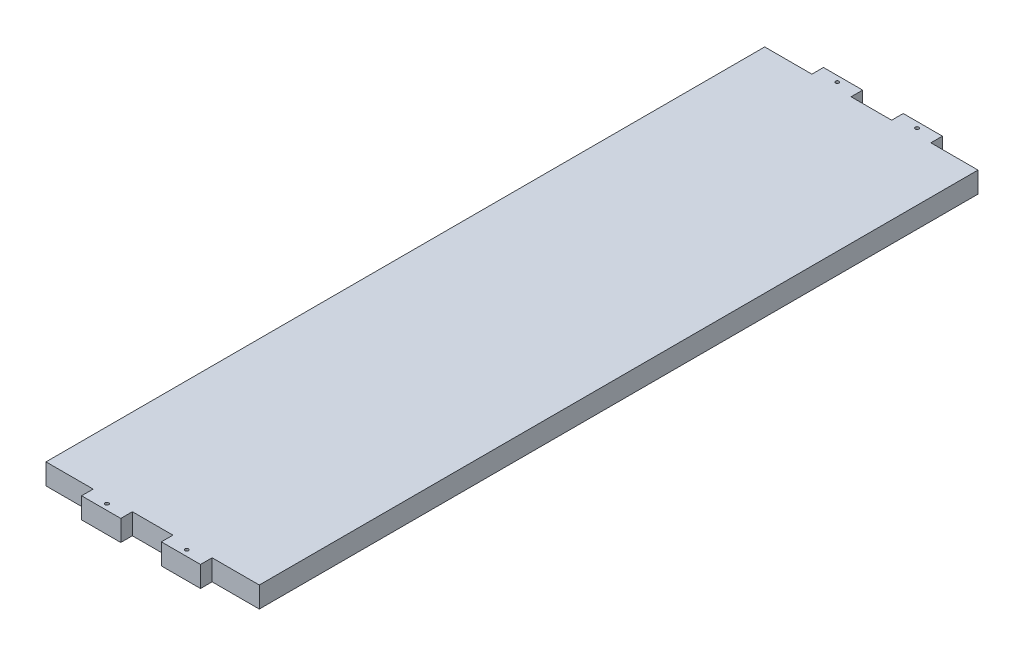
from build123d import *

# Parameters (mm, degrees)
SKETCH1_W                    = 184
SKETCH1_H                    = 18
BOSS_EXTRUDE1_DEPTH          = 658
CAVITY1_START                = -10
CAVITY1_OUTLINE_W            = 35
CAVITY1_OUTLINE_H            = 18
CAVITY1_OUTLINE_R            = 1.5
CAVITY1_OUTLINE_W_2          = 40.7
CAVITY1_DEPTH                = 10
CAVITY2_START                = -640
CAVITY2_OUTLINE_W            = 35
CAVITY2_OUTLINE_H            = 18
CAVITY2_OUTLINE_R            = 1.5
CAVITY2_OUTLINE_W_2          = 40.7
CAVITY2_DEPTH                = 10
SKETCH2_W                    = 184
SKETCH2_H                    = 18
CUT_EXTRUDE1_DEPTH           = 20
F_3_0_3_DIAMETER_HOLE1_D     = 3
F_3_0_3_DIAMETER_HOLE1_DEPTH = 25
F_3_0_3_DIAMETER_HOLE1_TIP   = 0.901290929
SKETCH5_W                    = 15.438081993
SKETCH5_H                    = 17.38610898
SKETCH5_W_2                  = 12.462066187
SKETCH5_W_3                  = 22.69212052
SKETCH5_W_4                  = 24.151046806
SKETCH5_H_2                  = 18.747641983
SKETCH5_W_5                  = 17.028403492
SKETCH5_H_3                  = 21.404849388
SKETCH5_W_6                  = 27.020251182
CUT_EXTRUDE2_DEPTH           = 20
F_3_0_3_DIAMETER_HOLE2_D     = 3
F_3_0_3_DIAMETER_HOLE2_DEPTH = 5
F_3_0_3_DIAMETER_HOLE2_TIP   = 0.901290929
CUT_EXTRUDE3_DEPTH           = 16


# Read off the part's stored shape, not the designer's step: Cavity1, Cavity2
with BuildPart() as part:
    # Sketch1 → Boss-Extrude1 (new body)
    with BuildSketch(Plane.XY):
        with Locations((-97.838367622, -1030.94)):
            Rectangle(SKETCH1_W, SKETCH1_H)
    extrude(amount=-BOSS_EXTRUDE1_DEPTH)

    # Cavity1 outline → Cavity1 (cut)
    # profile 1 of 3: a face of its own
    with BuildSketch(Plane.XY.offset(CAVITY1_START)):
        with Locations((-97.838367622, -1030.94)):
            Rectangle(CAVITY1_OUTLINE_W, CAVITY1_OUTLINE_H)
        with Locations((-97.838367622, -1030.94)):
            Circle(CAVITY1_OUTLINE_R, mode=Mode.SUBTRACT)
    # profile 2 of 3: a face of its own
    with BuildSketch(Plane.XY.offset(CAVITY1_START)):
        with Locations((-169.488367622, -1030.94)):
            Rectangle(CAVITY1_OUTLINE_W_2, CAVITY1_OUTLINE_H)
        with Locations((-169.488367622, -1030.94)):
            Circle(CAVITY1_OUTLINE_R, mode=Mode.SUBTRACT)
    # profile 3 of 3: a face of its own
    with BuildSketch(Plane.XY.offset(CAVITY1_START)):
        with Locations((-26.188367622, -1030.94)):
            Rectangle(CAVITY1_OUTLINE_W_2, CAVITY1_OUTLINE_H)
        with Locations((-26.188367622, -1030.94)):
            Circle(CAVITY1_OUTLINE_R, mode=Mode.SUBTRACT)
    extrude(amount=CAVITY1_DEPTH, mode=Mode.SUBTRACT)

    # Cavity2 outline → Cavity2 (cut)
    # profile 1 of 3: a face of its own
    with BuildSketch(Plane.XY.offset(CAVITY2_START)):
        with Locations((-97.838367622, -1030.94)):
            Rectangle(CAVITY2_OUTLINE_W, CAVITY2_OUTLINE_H)
        with Locations((-97.838367622, -1030.94)):
            Circle(CAVITY2_OUTLINE_R, mode=Mode.SUBTRACT)
    # profile 2 of 3: a face of its own
    with BuildSketch(Plane.XY.offset(CAVITY2_START)):
        with Locations((-169.488367622, -1030.94)):
            Rectangle(CAVITY2_OUTLINE_W_2, CAVITY2_OUTLINE_H)
        with Locations((-169.488367622, -1030.94)):
            Circle(CAVITY2_OUTLINE_R, mode=Mode.SUBTRACT)
    # profile 3 of 3: a face of its own
    with BuildSketch(Plane.XY.offset(CAVITY2_START)):
        with Locations((-26.188367622, -1030.94)):
            Rectangle(CAVITY2_OUTLINE_W_2, CAVITY2_OUTLINE_H)
        with Locations((-26.188367622, -1030.94)):
            Circle(CAVITY2_OUTLINE_R, mode=Mode.SUBTRACT)
    extrude(amount=CAVITY2_DEPTH, mode=Mode.SUBTRACT)

    # Sketch2 → Cut-Extrude1 (cut)
    with BuildSketch(Plane.XZ.offset(1039.94)):
        with Locations((-97.838367622, -649)):
            Rectangle(SKETCH2_W, SKETCH2_H)
    extrude(amount=-CUT_EXTRUDE1_DEPTH, mode=Mode.SUBTRACT)

    # Ø3.0 (3) Diameter Hole1
    with Locations(Plane(origin=(0, -1039.94, 0), x_dir=(-1, 0, 0), z_dir=(0, -1, 0))):
        with Locations((132.238367622, 5), (63.438367622, 5), (63.438367622, 635), (132.238367622, 635)):
            Hole(F_3_0_3_DIAMETER_HOLE1_D / 2, depth=F_3_0_3_DIAMETER_HOLE1_DEPTH)
            with Locations((0, 0, -(F_3_0_3_DIAMETER_HOLE1_DEPTH + F_3_0_3_DIAMETER_HOLE1_TIP / 2))):  # 118° drill point
                Cone(0, F_3_0_3_DIAMETER_HOLE1_D / 2, F_3_0_3_DIAMETER_HOLE1_TIP, mode=Mode.SUBTRACT)

    # Sketch5 → Cut-Extrude2 (cut)
    with BuildSketch(Plane.XZ.offset(1039.94)):
        with Locations((-168.439296688, -638.69305449)):
            Rectangle(SKETCH5_W, SKETCH5_H)
        with Locations((-97.014917346, -638.69305449)):
            Rectangle(SKETCH5_W_2, SKETCH5_H)
        with Locations((-26.055540475, -638.69305449)):
            Rectangle(SKETCH5_W_3, SKETCH5_H)
        with Locations((-172.795779094, -0.626179008)):
            Rectangle(SKETCH5_W_4, SKETCH5_H_2)
        with Locations((-99.298085999, 0.702424694)):
            Rectangle(SKETCH5_W_5, SKETCH5_H_3)
        with Locations((-23.891475144, 0.702424694)):
            Rectangle(SKETCH5_W_6, SKETCH5_H_3)
    extrude(amount=-CUT_EXTRUDE2_DEPTH, mode=Mode.SUBTRACT)

    # Ø3.0 (3) Diameter Hole2
    with Locations(Plane(origin=(0, -1039.94, 0), x_dir=(-1, 0, 0), z_dir=(0, -1, 0))):
        with Locations((97.838367622, 64), (97.838367622, 384), (97.838367622, 576), (97.838367622, 192), (97.838367622, 15.63)):
            Hole(F_3_0_3_DIAMETER_HOLE2_D / 2, depth=F_3_0_3_DIAMETER_HOLE2_DEPTH)
            with Locations((0, 0, -(F_3_0_3_DIAMETER_HOLE2_DEPTH + F_3_0_3_DIAMETER_HOLE2_TIP / 2))):  # 118° drill point
                Cone(0, F_3_0_3_DIAMETER_HOLE2_D / 2, F_3_0_3_DIAMETER_HOLE2_TIP, mode=Mode.SUBTRACT)

    # Sketch8 → Cut-Extrude3 (cut)
    with BuildSketch(Plane.XZ.offset(1039.94)):
        with BuildLine():
            Line((-108.088367622, -85.802173793), (-108.088367622, -74.197826207))
            ThreePointArc((-108.088367622, -74.197826207), (-106.088367622, -72.197826207), (-104.088367622, -74.197826207))
            Line((-104.088367622, -74.197826207), (-104.088367622, -85.802173793))
            ThreePointArc((-104.088367622, -85.802173793), (-106.088367622, -87.802173793), (-108.088367622, -85.802173793))
        make_face()
        with BuildLine():
            Line((-108.088367622, -373.121722836), (-108.088367622, -362.878277164))
            ThreePointArc((-108.088367622, -362.878277164), (-106.088367622, -360.878277164), (-104.088367622, -362.878277164))
            Line((-104.088367622, -362.878277164), (-104.088367622, -373.121722836))
            ThreePointArc((-104.088367622, -373.121722836), (-106.088367622, -375.121722836), (-108.088367622, -373.121722836))
        make_face()
        with BuildLine():
            Line((-108.088367622, -565.121722836), (-108.088367622, -554.878277164))
            ThreePointArc((-108.088367622, -554.878277164), (-106.088367622, -552.878277164), (-104.088367622, -554.878277164))
            Line((-104.088367622, -554.878277164), (-104.088367622, -565.121722836))
            ThreePointArc((-104.088367622, -565.121722836), (-106.088367622, -567.121722836), (-108.088367622, -565.121722836))
        make_face()
    extrude(amount=-CUT_EXTRUDE3_DEPTH, mode=Mode.SUBTRACT)


solid = part.part
